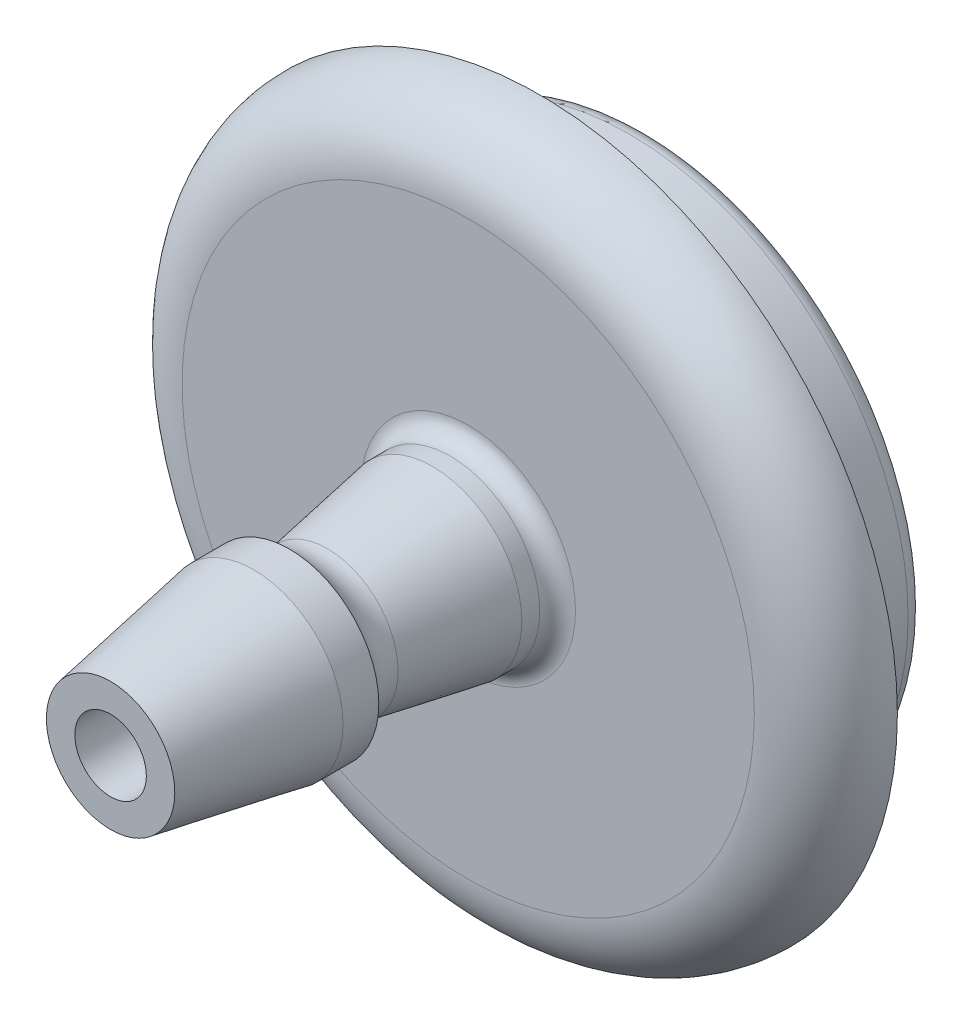
from build123d import *

# Parameters (mm, degrees)
SKETCH1_R                   = 2.5
SKETCH1_R_2                 = 1
BOSS_EXTRUDE1_DEPTH         = 5
CHAMFER2_SIZE               = 4
CHAMFER2_SIZE2              = 0.705307923
LPATTERN2_COUNT             = 2
LPATTERN2_PITCH             = 5
CHAMFER2_OF_LPATTERN2_SIZE2 = 0.705307923
CHAMFER2_OF_LPATTERN2_SIZE  = 4
FILLET1_R                   = 1
SKETCH2_R                   = 10
BOSS_EXTRUDE2_DEPTH         = 2
CUT_EXTRUDE2_START          = -15
SKETCH4_R                   = 1
CUT_EXTRUDE2_DEPTH          = 15
FILLET3_R                   = 2
SKETCH5_R                   = 7.8
SKETCH5_R_2                 = 6
BOSS_EXTRUDE3_DEPTH         = 5
FILLET4_R                   = 2
FILLET5_R                   = 0.5
FILLET6_R                   = 0.5


# Some blends are built 0.0001 mm under size
with BuildPart() as part:
    # Sketch1 → Boss-Extrude1 (new body)
    with BuildSketch(Plane.XY):
        Circle(SKETCH1_R)
        Circle(SKETCH1_R_2, mode=Mode.SUBTRACT)
    boss_extrude1 = extrude(amount=BOSS_EXTRUDE1_DEPTH)

    # Chamfer2
    chamfer2_edges = [part.edges().sort_by_distance(p)[0] for p in [
        (-2.5, 0, 5),
    ]]
    chamfer2_side = [part.faces().sort_by_distance(p)[0] for p in [
        (-2.5, 0, 2.5),
    ]]
    chamfer(chamfer2_edges, length=CHAMFER2_SIZE, length2=CHAMFER2_SIZE2, reference=chamfer2_side[0])


with BuildPart() as lpattern2_1:
    # LPattern2: Boss-Extrude1 ×2
    with Locations(*[(0, 0, i * LPATTERN2_PITCH) for i in range(1, LPATTERN2_COUNT)]):
        add(boss_extrude1)

    # Chamfer2 of LPattern2
    chamfer2_of_lpattern2_edges = [lpattern2_1.edges().sort_by_distance(p)[0] for p in [
        (-2.5, 0, 10),
    ]]
    chamfer(chamfer2_of_lpattern2_edges, length=CHAMFER2_OF_LPATTERN2_SIZE, length2=CHAMFER2_OF_LPATTERN2_SIZE2)


with BuildPart() as part_1:
    add(part.part)

    # LPattern2 united with what the copies to: union LPattern2_1
    add(lpattern2_1.part)

    # Fillet1
    # the kernel refuses this fillet: 1 mm, written as the material it adds along each edge
    with BuildSketch(Plane(origin=(0, 0, 5), x_dir=(1, 0, 0), z_dir=(0, -1, 0))) as fillet1_piece_1:
        with BuildLine():
            CenterArc((2.96611905, -0.884722008), FILLET1_R, 117.782669079, 72.217330921)
            Line((1.981311297, -1.058370186), (1.961615141, -1.061843149))
            Line((1.961615141, -1.061843149), (1.774995922, -0.003472964))
            Line((1.774995922, -0.003472964), (1.794692077, 0.02))
            ThreePointArc((1.794692077, 0.02), (2.147346039, 0.02), (2.490677619, 0.01769444))
            Line((2.490677619, 0.01769444), (2.5, 0))
        make_face()
    revolve(axis=Axis((0, 0, 5), (0, 0, 1)))

    # Sketch2 → Boss-Extrude2 (add)
    with BuildSketch(Plane.XY):
        Circle(SKETCH2_R)
    extrude(amount=-BOSS_EXTRUDE2_DEPTH)

    # Sketch4 → Cut-Extrude2 (cut)
    with BuildSketch(Plane.XY.offset(CUT_EXTRUDE2_START)):
        Circle(SKETCH4_R)
    extrude(amount=CUT_EXTRUDE2_DEPTH, mode=Mode.SUBTRACT)

    # Fillet3
    fillet3_edges = [part_1.edges().sort_by_distance(p)[0] for p in [
        (-1, 0, -2),
    ]]
    fillet(fillet3_edges, radius=FILLET3_R)

    # Sketch5 → Boss-Extrude3 (add)
    with BuildSketch(Plane.XY):
        Circle(SKETCH5_R)
        Circle(SKETCH5_R_2, mode=Mode.SUBTRACT)
    extrude(amount=-BOSS_EXTRUDE3_DEPTH)

    # Fillet4
    fillet4_edges = [part_1.edges().sort_by_distance(p)[0] for p in [
        (-10, 0, 0),
    ]]
    fillet(fillet4_edges, radius=FILLET4_R - 0.0001)  # a hair under: the kernel refuses the full size

    # Fillet5
    fillet5_edges = [part_1.edges().sort_by_distance(p)[0] for p in [
        (-2.5, 0, 0),
    ]]
    fillet(fillet5_edges, radius=FILLET5_R)

    # Fillet6
    fillet6_edges = [part_1.edges().sort_by_distance(p)[0] for p in [
        (-7.8, 0, -5),
    ]]
    fillet(fillet6_edges, radius=FILLET6_R)


solid = part_1.part
